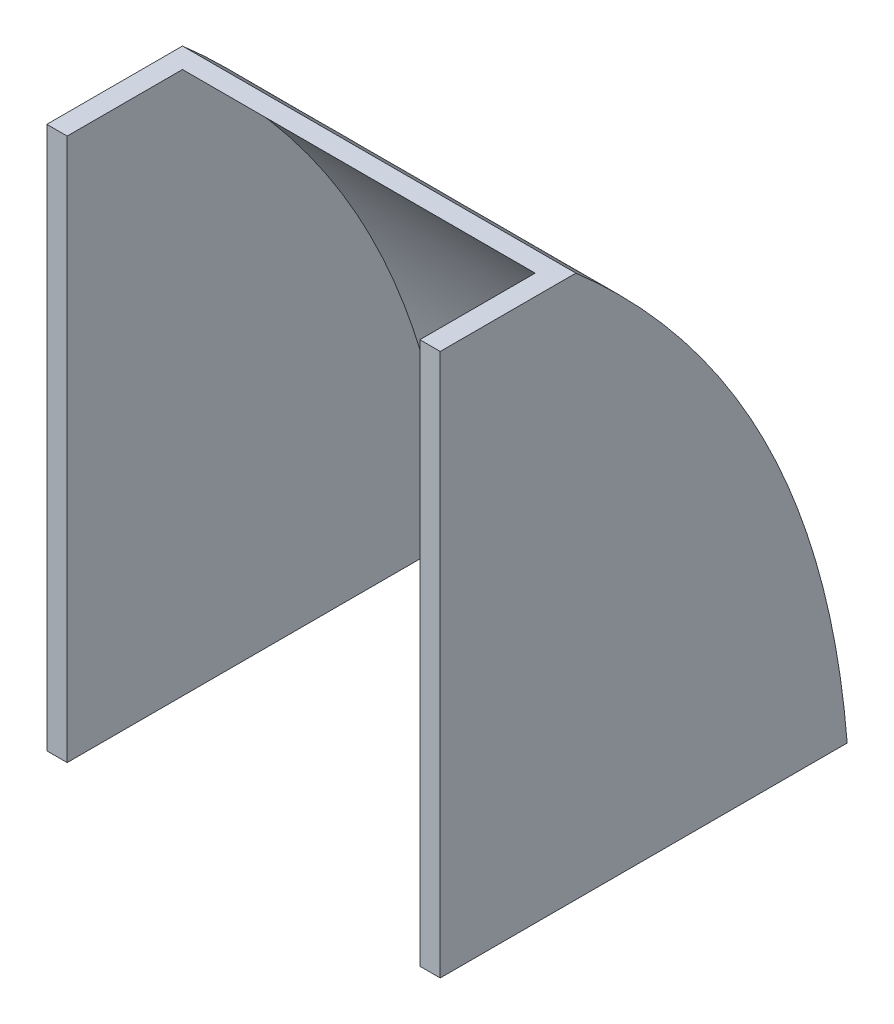
from build123d import *

# Parameters (mm, degrees)
BOSS_EXTRUDE1_DEPTH = 29
CUT_EXTRUDE1_START  = 1.5
CUT_EXTRUDE1_DEPTH  = 26


# Read off the part's stored shape, not the designer's step: Cut-Extrude1
with BuildPart() as part:
    # Sketch1 → Boss-Extrude1 (new body)
    with BuildSketch(Plane(origin=(0, 0, 0), x_dir=(0, 0, -1), z_dir=(1, 0, 0))):
        with BuildLine():
            Line((0, 40), (0, 0))
            Line((0, 0), (30, 0))
            add(Edge.make_bspline(
                [(10, 40), (28.045726498, 24.235315383), (30, 0)],
                knots=[0, 0, 0, 1, 1, 1], degree=2))
            Line((10, 40), (0, 40))
        make_face()
    extrude(amount=BOSS_EXTRUDE1_DEPTH)

    # Cut-Extrude1 outline → Cut-Extrude1 (cut)
    with BuildSketch(Plane.YZ.offset(CUT_EXTRUDE1_START)):
        with BuildLine():
            Line((0, 0), (0, -28.5))
            add(Edge.make_bspline(
                [(0, -28.5), (24.235315383, -26.545726498), (40, -8.5)],
                knots=[0, 0, 0, 1, 1, 1], degree=2))
            Line((40, -8.5), (40, 0))
            Line((40, 0), (0, 0))
        make_face()
    extrude(amount=CUT_EXTRUDE1_DEPTH, mode=Mode.SUBTRACT)


solid = part.part
